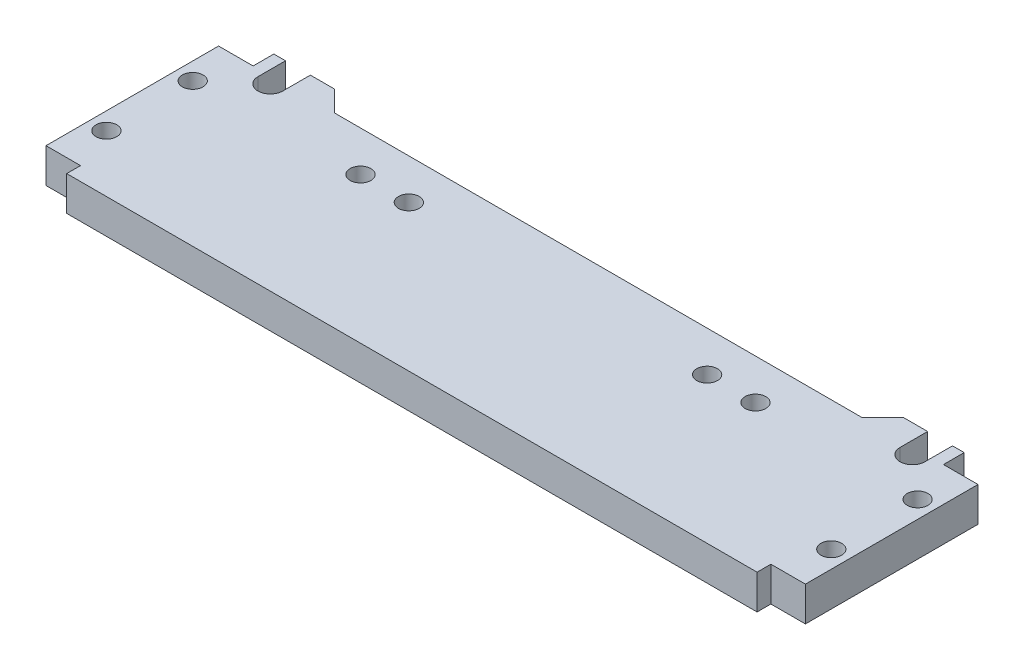
from build123d import *

# Parameters (mm, degrees)
SKETCH1_W                      = 27
SKETCH1_H                      = 5
BOSS_EXTRUDE1_DEPTH            = 110
M3_TAPPED_HOLE1_AT_2_COUNT     = 2
M3_TAPPED_HOLE1_AT_2_PITCH     = 7
SKETCH6_W                      = 5
SKETCH6_H                      = 2
CUT_EXTRUDE1_DEPTH             = 10
BOSS_EXTRUDE2_DEPTH            = 5
CUT_EXTRUDE3_DEPTH             = 10
CHAMFER1_SIZE                  = 3
CHAMFER1_OF_MIRROR8_SIZE       = 3
F_3_0MM_DOWEL_HOLE1_AT_2_COUNT = 2
F_3_0MM_DOWEL_HOLE1_AT_2_PITCH = 12.5


with BuildPart() as part:
    # Sketch1 → Boss-Extrude1 (new body)
    with BuildSketch(Plane(origin=(0, 0, 0), x_dir=(0, 0, -1), z_dir=(1, 0, 0))):
        with Locations((-3.636889684, 3.101965352)):
            Rectangle(SKETCH1_W, SKETCH1_H)
    extrude(amount=BOSS_EXTRUDE1_DEPTH)

    # Sketch14 → M3 Tapped Hole1 (revolve, cut)
    with BuildSketch(Plane(origin=(26.397029049, 5.601965352, -4.022332737), x_dir=(0, 0, 1), z_dir=(1, 0, 0))):
        Polygon((0, 0), (0, 8.251075774), (1.25, 7.5), (1.25, 6), (1.5, 6), (1.5, 0), align=None)
    m3_tapped_hole1 = revolve(axis=Axis((26.397029049, 11.951965352, -4.022332737), (0, -1, 0)), mode=Mode.SUBTRACT)

    # M3 Tapped Hole1 at 2: M3 Tapped Hole1 ×2
    with Locations(*[(i * M3_TAPPED_HOLE1_AT_2_PITCH, 0, 0) for i in range(1, M3_TAPPED_HOLE1_AT_2_COUNT)]):
        add(m3_tapped_hole1, mode=Mode.SUBTRACT)

    # Mirror3: M3 Tapped Hole1 across plane
    add(m3_tapped_hole1.mirror(Plane(origin=(55, 0, 0), x_dir=(0, 0, 1), z_dir=(1, 0, 0))), mode=Mode.SUBTRACT)

    # Mirror3 copy 1 sketch → Mirror3 copy 1 (revolve, cut)
    with BuildSketch(Plane(origin=(76.602970951, 5.601965352, -4.022332737), x_dir=(0, 0, 1), z_dir=(-1, 0, 0))):
        Polygon((0, 0), (0, -8.251075774), (1.25, -7.5), (1.25, -6), (1.5, -6), (1.5, 0), align=None)
    revolve(axis=Axis((76.602970951, 11.951965352, -4.022332737), (0, 1, 0)), mode=Mode.SUBTRACT)

    # Sketch6 → Cut-Extrude1 (cut)
    with BuildSketch(Plane(origin=(0, 5.601965352, 0), x_dir=(1, 0, 0), z_dir=(0, 1, 0))):
        with Locations((2.5, -16.136889684)):
            Rectangle(SKETCH6_W, SKETCH6_H)
    cut_extrude1 = extrude(amount=-CUT_EXTRUDE1_DEPTH, mode=Mode.SUBTRACT)

    # Mirror4: Cut-Extrude1 across plane
    add(cut_extrude1.mirror(Plane(origin=(55, 0, 0), x_dir=(0, 0, 1), z_dir=(1, 0, 0))), mode=Mode.SUBTRACT)

    # Sketch17 → Boss-Extrude2 (add)
    with BuildSketch(Plane(origin=(0, 5.601965352, 0), x_dir=(1, 0, 0), z_dir=(0, 1, 0))):
        Polygon((105, 9.863110316), (105, 12.863110316), (103.25, 12.863110316), (99.674047562, 12.863110316), (93.200232163, 12.863110316), (93.200232163, 9.863110316), (97.924047562, 9.863110316), align=None)
    boss_extrude2 = extrude(amount=-BOSS_EXTRUDE2_DEPTH)

    # Sketch22 → Cut-Extrude3 (cut)
    with BuildSketch(Plane(origin=(0, 5.601965352, 0), x_dir=(1, 0, 0), z_dir=(0, 1, 0))):
        with BuildLine():
            Line((101.505065332, 12.863110316), (103.305065332, 12.863110316))
            Line((103.305065332, 12.863110316), (103.305065332, 8.863110316))
            ThreePointArc((103.305065332, 8.863110316), (101.505065332, 7.063110316), (99.705065332, 8.863110316))
            Line((99.705065332, 8.863110316), (99.705065332, 12.863110316))
            Line((99.705065332, 12.863110316), (101.505065332, 12.863110316))
        make_face()
    cut_extrude3 = extrude(amount=-CUT_EXTRUDE3_DEPTH, mode=Mode.SUBTRACT)

    # Chamfer1
    chamfer1_edges = [part.edges().sort_by_distance(p)[0] for p in [
        (93.200232163, 3.101965352, -12.863110316),
    ]]
    chamfer(chamfer1_edges, length=CHAMFER1_SIZE - 0.0001)  # a hair under: the kernel refuses the full size

    # Mirror8: Boss-Extrude2, Cut-Extrude3 across plane
    add(boss_extrude2.mirror(Plane.ZY.offset(-55)))
    add(cut_extrude3.mirror(Plane.ZY.offset(-55)), mode=Mode.SUBTRACT)

    # Chamfer1 of Mirror8
    chamfer1_of_mirror8_edges = [part.edges().sort_by_distance(p)[0] for p in [
        (16.799767837, 3.101965352, -12.863110316),
    ]]
    chamfer(chamfer1_of_mirror8_edges, length=CHAMFER1_OF_MIRROR8_SIZE - 0.0001)  # a hair under: the kernel refuses the full size

    # Sketch24 → Ø3.0mm Dowel Hole1 (revolve, cut)
    with BuildSketch(Plane(origin=(107.5, 0.601965352, -3.613110316), x_dir=(0, 0, -1), z_dir=(1, 0, 0))):
        Polygon((0, 0), (0, 20.901290929), (1.5, 20), (1.5, 0), align=None)
    f_3_0mm_dowel_hole1 = revolve(axis=Axis((107.5, -5.748034648, -3.613110316), (0, 1, 0)), mode=Mode.SUBTRACT)

    # Ø3.0mm Dowel Hole1 at 2: Ø3.0mm Dowel Hole1 ×2
    with Locations(*[(0, 0, i * F_3_0MM_DOWEL_HOLE1_AT_2_PITCH) for i in range(1, F_3_0MM_DOWEL_HOLE1_AT_2_COUNT)]):
        add(f_3_0mm_dowel_hole1, mode=Mode.SUBTRACT)

    # Mirror9: Ø3.0mm Dowel Hole1 across plane
    add(f_3_0mm_dowel_hole1.mirror(Plane.ZY.offset(-55)), mode=Mode.SUBTRACT)

    # Mirror9 copy 1 sketch → Mirror9 copy 1 (revolve, cut)
    with BuildSketch(Plane(origin=(2.5, 0.601965352, 8.886889684), x_dir=(0, 0, -1), z_dir=(-1, 0, 0))):
        Polygon((0, 0), (0, -20.901290929), (1.5, -20), (1.5, 0), align=None)
    revolve(axis=Axis((2.5, -5.748034648, 8.886889684), (0, -1, 0)), mode=Mode.SUBTRACT)


solid = part.part
